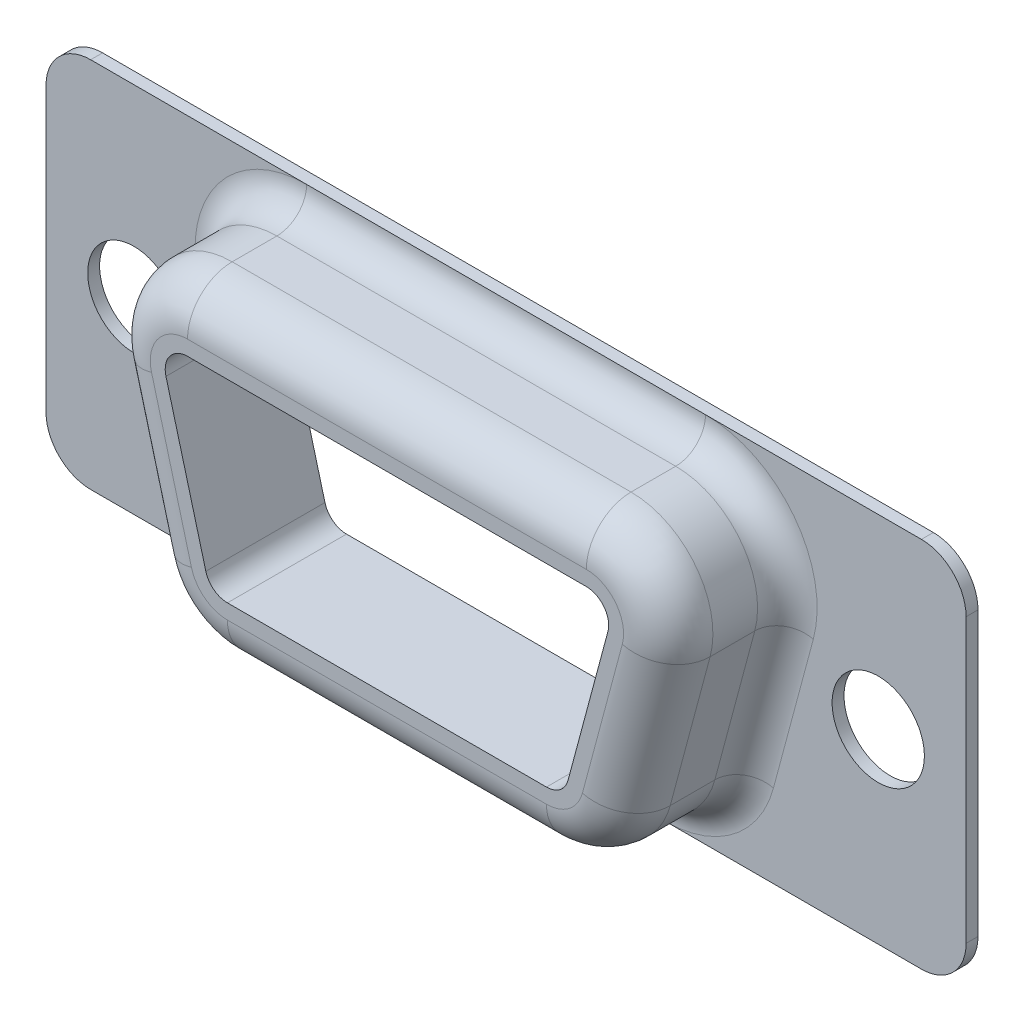
from build123d import *

# Parameters (mm, degrees)
SKETCH1_R           = 1.55
BOSS_EXTRUDE1_DEPTH = 0.4
BOSS_EXTRUDE2_DEPTH = 4
FILLET1_R           = 1
FILLET2_R           = 1.5


with BuildPart() as part:
    # Sketch1 → Boss-Extrude1 (new body)
    with BuildSketch(Plane.XY):
        with BuildLine():
            Line((13.95, 6.25), (-13.95, 6.25))
            ThreePointArc((-13.95, 6.25), (-15.010660172, 5.810660172), (-15.45, 4.75))
            Line((-15.45, 4.75), (-15.45, -4.75))
            ThreePointArc((-15.45, -4.75), (-15.010660172, -5.810660172), (-13.95, -6.25))
            Line((-13.95, -6.25), (13.95, -6.25))
            ThreePointArc((13.95, -6.25), (15.010660172, -5.810660172), (15.45, -4.75))
            Line((15.45, -4.75), (15.45, 4.75))
            ThreePointArc((15.45, 4.75), (15.010660172, 5.810660172), (13.95, 6.25))
        make_face()
        with Locations((-12.5, 0)):
            Circle(SKETCH1_R, mode=Mode.SUBTRACT)
        with BuildLine():
            Line((-6.806228507, -2.888228568), (-8.145974469, 2.111771432))
            ThreePointArc((-8.145974469, 2.111771432), (-7.88711574, 3.413142144), (-6.697085729, 4))
            Line((-6.697085729, 4), (6.697085729, 4))
            ThreePointArc((6.697085729, 4), (7.88711574, 3.413142144), (8.145974469, 2.111771432))
            Line((8.145974469, 2.111771432), (6.806228507, -2.888228568))
            ThreePointArc((6.806228507, -2.888228568), (6.270481911, -3.69003001), (5.357339767, -4))
            Line((5.357339767, -4), (-5.357339767, -4))
            ThreePointArc((-5.357339767, -4), (-6.270481911, -3.69003001), (-6.806228507, -2.888228568))
        make_face(mode=Mode.SUBTRACT)
        with Locations((12.5, 0)):
            Circle(SKETCH1_R, mode=Mode.SUBTRACT)
    extrude(amount=BOSS_EXTRUDE1_DEPTH)

    # Sketch2 → Boss-Extrude2 (add)
    with BuildSketch(Plane.XY.offset(0.4)):
        with BuildLine():
            Line((-9.353381752, 1.788247626), (-8.01363579, -3.211752374))
            ThreePointArc((-8.01363579, -3.211752374), (-7.031433697, -4.681721686), (-5.357339767, -5.25))
            Line((-5.357339767, -5.25), (5.357339767, -5.25))
            ThreePointArc((5.357339767, -5.25), (7.031433697, -4.681721686), (8.01363579, -3.211752374))
            Line((8.01363579, -3.211752374), (9.353381752, 1.788247626))
            ThreePointArc((9.353381752, 1.788247626), (8.878807415, 4.17409393), (6.697085729, 5.25))
            Line((6.697085729, 5.25), (-6.697085729, 5.25))
            ThreePointArc((-6.697085729, 5.25), (-8.878807415, 4.17409393), (-9.353381752, 1.788247626))
        make_face()
        with BuildLine():
            Line((-5.357339767, -3.25), (5.357339767, -3.25))
            ThreePointArc((5.357339767, -3.25), (5.813910839, -3.095015005), (6.081784137, -2.694114284))
            Line((6.081784137, -2.694114284), (7.421530099, 2.305885716))
            ThreePointArc((7.421530099, 2.305885716), (7.292100735, 2.956571072), (6.697085729, 3.25))
            Line((6.697085729, 3.25), (-6.697085729, 3.25))
            ThreePointArc((-6.697085729, 3.25), (-7.292100735, 2.956571072), (-7.421530099, 2.305885716))
            Line((-7.421530099, 2.305885716), (-6.081784137, -2.694114284))
            ThreePointArc((-6.081784137, -2.694114284), (-5.813910839, -3.095015005), (-5.357339767, -3.25))
        make_face(mode=Mode.SUBTRACT)
    extrude(amount=BOSS_EXTRUDE2_DEPTH)

    # Fillet1
    fillet1_edges = [part.edges().sort_by_distance(p)[0] for p in [
        (-8.878807415, 4.17409393, 0.4),
        (-8.683508771, -0.711752374, 0.4),
        (-7.031433697, -4.681721686, 0.4),
        (0, -5.25, 0.4),
        (7.031433697, -4.681721686, 0.4),
        (8.683508771, -0.711752374, 0.4),
        (8.878807415, 4.17409393, 0.4),
        (0, 5.25, 0.4),
    ]]
    fillet(fillet1_edges, radius=FILLET1_R - 0.0001)  # a hair under: the kernel refuses the full size

    # Fillet2
    fillet2_edges = [part.edges().sort_by_distance(p)[0] for p in [
        (-8.878807415, 4.17409393, 4.4),
        (-8.683508771, -0.711752374, 4.4),
        (-7.031433697, -4.681721686, 4.4),
        (0, -5.25, 4.4),
        (7.031433697, -4.681721686, 4.4),
        (8.683508771, -0.711752374, 4.4),
        (8.878807415, 4.17409393, 4.4),
        (0, 5.25, 4.4),
    ]]
    fillet(fillet2_edges, radius=FILLET2_R)


solid = part.part
